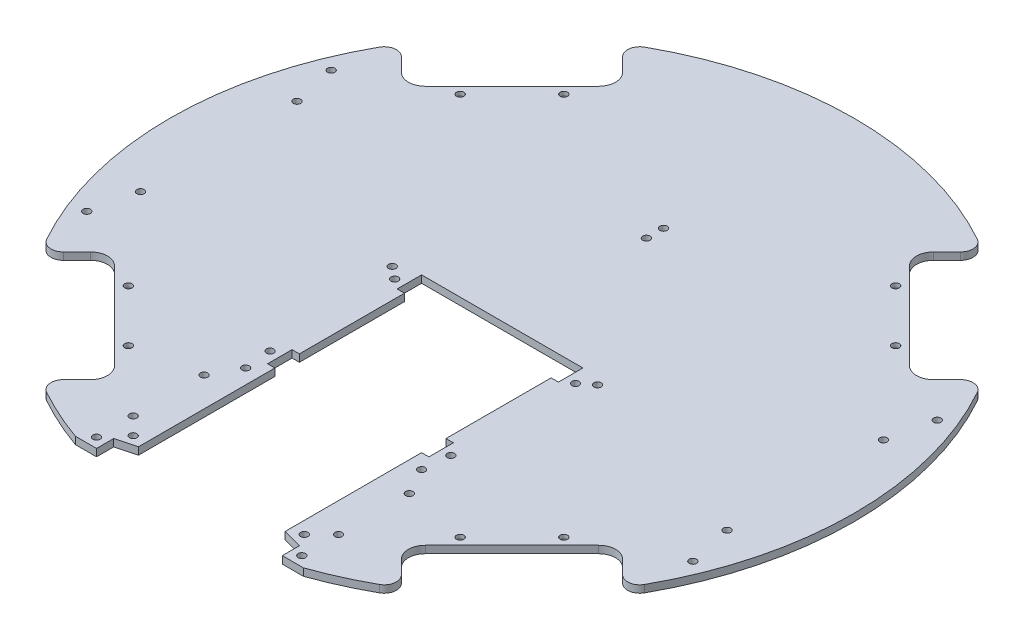
from build123d import *

# Parameters (mm, degrees)
SKETCH1_R                = 140
BOSS_EXTRUDE1_DEPTH      = 3
CUT_EXTRUDE4_REACH       = 200.013
CUT_EXTRUDE6_REACH       = 200.013
SKETCH9_R                = 1.5
FILLET1_R                = 5
CIRPATTERN1_COUNT        = 4
FILLET1_OF_CIRPATTERN1_R = 5
CUT_EXTRUDE1_REACH       = 200.013
FILLET3_R                = 1.5
CUT_EXTRUDE7_REACH       = 200.013
SKETCH10_R               = 1.5
CUT_EXTRUDE9_REACH       = 200.013
SKETCH13_R               = 1.5
CUT_EXTRUDE12_REACH      = 200.013
SKETCH16_R               = 1.5
CUT_EXTRUDE13_REACH      = 200.013
SKETCH17_R               = 1.5
CUT_EXTRUDE15_REACH      = 200.013
SKETCH19_R               = 1.5
CUT_EXTRUDE17_REACH      = 200.013
SKETCH21_R               = 1.5
CUT_EXTRUDE18_REACH      = 200.013
SKETCH22_R               = 1.5


with BuildPart() as part:
    # Sketch1 → Boss-Extrude1 (new body)
    with BuildSketch(Plane(origin=(0, 0, 0), x_dir=(1, 0, 0), z_dir=(0, 1, 0))):
        Circle(SKETCH1_R)
    extrude(amount=BOSS_EXTRUDE1_DEPTH)

    # Sketch7 → Cut-Extrude4 (cut, up to next)
    with BuildSketch(Plane(origin=(0, 3, 0), x_dir=(1, 0, 0), z_dir=(0, 1, 0)), mode=Mode.PRIVATE) as cut_extrude4_sk1:
        with BuildLine():
            Line((-99.030304705, -63.604254968), (-63.604254968, -99.030304705))
            ThreePointArc((-63.604254968, -99.030304705), (-61.568647097, -103.944696834), (-63.604254968, -108.859088964))
            Line((-63.604254968, -108.859088964), (-76.367532368, -121.622366364))
            Line((-76.367532368, -121.622366364), (-121.622366364, -76.367532368))
            Line((-121.622366364, -76.367532368), (-108.859088964, -63.604254968))
            ThreePointArc((-108.859088964, -63.604254968), (-103.944696834, -61.568647097), (-99.030304705, -63.604254968))
        make_face()
    cut_extrude4_tool1 = extrude(cut_extrude4_sk1.sketch, amount=-CUT_EXTRUDE4_REACH, mode=Mode.PRIVATE) & part.part
    cut_extrude4 = cut_extrude4_tool1.solids().sort_by_distance((-90.257735, 3, 90.257735))[0]
    add(cut_extrude4, mode=Mode.SUBTRACT)

    # Sketch9 → Cut-Extrude6 (cut, up to next)
    with BuildSketch(Plane(origin=(0, 3, 0), x_dir=(1, 0, 0), z_dir=(0, 1, 0)), mode=Mode.PRIVATE) as cut_extrude6_sk1:
        with Locations((-89.09545443, -67.882250994)):
            Circle(SKETCH9_R)
    cut_extrude6_tool1 = extrude(cut_extrude6_sk1.sketch, amount=-CUT_EXTRUDE6_REACH, mode=Mode.PRIVATE) & part.part
    # Sketch9 → Cut-Extrude6 (cut, up to next)
    with BuildSketch(Plane(origin=(0, 3, 0), x_dir=(1, 0, 0), z_dir=(0, 1, 0)), mode=Mode.PRIVATE) as cut_extrude6_sk2:
        with Locations((-67.882250994, -89.09545443)):
            Circle(SKETCH9_R)
    cut_extrude6_tool2 = extrude(cut_extrude6_sk2.sketch, amount=-CUT_EXTRUDE6_REACH, mode=Mode.PRIVATE) & part.part
    cut_extrude6_1 = cut_extrude6_tool1.solids().sort_by_distance((-89.095454, 3, 67.882251))[0]
    add(cut_extrude6_1, mode=Mode.SUBTRACT)
    cut_extrude6_2 = cut_extrude6_tool2.solids().sort_by_distance((-67.882251, 3, 89.095454))[0]
    add(cut_extrude6_2, mode=Mode.SUBTRACT)
    cut_extrude6 = cut_extrude6_1 + cut_extrude6_2  # Cut-Extrude6 as one shape, for the pattern or mirror that repeats it

    # Fillet1
    fillet1_edges = [part.edges().sort_by_distance(p)[0] for p in [
        (-73.746853427, 1.5, 119.001687423),
        (-119.001687423, 1.5, 73.746853427),
    ]]
    fillet(fillet1_edges, radius=FILLET1_R)

    # CirPattern1: Cut-Extrude4, Cut-Extrude6 ×4 about axis
    cirpattern1_axis = Axis((0, 3, 0), (0, 1, 0))
    add([cut_extrude4.rotate(cirpattern1_axis, i * 360 / CIRPATTERN1_COUNT) for i in range(1, CIRPATTERN1_COUNT)], mode=Mode.SUBTRACT)
    add([cut_extrude6.rotate(cirpattern1_axis, i * 360 / CIRPATTERN1_COUNT) for i in range(1, CIRPATTERN1_COUNT)], mode=Mode.SUBTRACT)

    # Fillet1 of CirPattern1
    fillet1_of_cirpattern1_edges = [part.edges().sort_by_distance(p)[0] for p in [
        (119.001687423, 1.5, 73.746853427),
        (73.746853427, 1.5, 119.001687423),
        (73.746853427, 1.5, -119.001687423),
        (119.001687423, 1.5, -73.746853427),
        (-119.001687423, 1.5, -73.746853427),
        (-73.746853427, 1.5, -119.001687423),
    ]]
    fillet(fillet1_of_cirpattern1_edges, radius=FILLET1_OF_CIRPATTERN1_R)

    # Sketch2 → Cut-Extrude1 (cut, up to next)
    with BuildSketch(Plane(origin=(0, 3, 0), x_dir=(1, 0, 0), z_dir=(0, 1, 0)), mode=Mode.PRIVATE) as cut_extrude1_sk1:
        Polygon((-46.647615159, -132), (-38, -132), (-38, -125), (-30, -122.856406461), (-30, -67), (-33, -67), (-33, -57), (-30, -57), (-30, -14), (-33, -14), (-33, -4), (33, -4), (33, -14), (30, -14), (30, -57), (33, -57), (33, -67), (30, -67), (30, -122.856406461), (38, -125), (38, -132), (46.647615159, -132), (46.647615159, -140), (-46.647615159, -140), align=None)
    cut_extrude1_tool1 = extrude(cut_extrude1_sk1.sketch, amount=-CUT_EXTRUDE1_REACH, mode=Mode.PRIVATE) & part.part
    add(cut_extrude1_tool1.solids().sort_by_distance((0, 3, 74.292867))[0], mode=Mode.SUBTRACT)

    # Fillet3
    fillet3_edges = [part.edges().sort_by_distance(p)[0] for p in [
        (67.882250994, 0, 90.59545443),
        (89.09545443, 0, 69.382250994),
        (90.59545443, 0, -67.882250994),
        (69.382250994, 0, -89.09545443),
        (-67.882250994, 0, -90.59545443),
        (-89.09545443, 0, -69.382250994),
        (-69.382250994, 0, 89.09545443),
        (-90.59545443, 0, 67.882250994),
    ]]
    fillet(fillet3_edges, radius=FILLET3_R)

    # Sketch10 → Cut-Extrude7 (cut, up to next)
    with BuildSketch(Plane(origin=(0, 3, 0), x_dir=(1, 0, 0), z_dir=(0, 1, 0)), mode=Mode.PRIVATE) as cut_extrude7_sk1:
        with Locations((-37, -62)):
            Circle(SKETCH10_R)
    cut_extrude7_tool1 = extrude(cut_extrude7_sk1.sketch, amount=-CUT_EXTRUDE7_REACH, mode=Mode.PRIVATE) & part.part
    # Sketch10 → Cut-Extrude7 (cut, up to next)
    with BuildSketch(Plane(origin=(0, 3, 0), x_dir=(1, 0, 0), z_dir=(0, 1, 0)), mode=Mode.PRIVATE) as cut_extrude7_sk2:
        with Locations((37, -62)):
            Circle(SKETCH10_R)
    cut_extrude7_tool2 = extrude(cut_extrude7_sk2.sketch, amount=-CUT_EXTRUDE7_REACH, mode=Mode.PRIVATE) & part.part
    # Sketch10 → Cut-Extrude7 (cut, up to next)
    with BuildSketch(Plane(origin=(0, 3, 0), x_dir=(1, 0, 0), z_dir=(0, 1, 0)), mode=Mode.PRIVATE) as cut_extrude7_sk3:
        with Locations((-37, -11)):
            Circle(SKETCH10_R)
    cut_extrude7_tool3 = extrude(cut_extrude7_sk3.sketch, amount=-CUT_EXTRUDE7_REACH, mode=Mode.PRIVATE) & part.part
    # Sketch10 → Cut-Extrude7 (cut, up to next)
    with BuildSketch(Plane(origin=(0, 3, 0), x_dir=(1, 0, 0), z_dir=(0, 1, 0)), mode=Mode.PRIVATE) as cut_extrude7_sk4:
        with Locations((37, -11)):
            Circle(SKETCH10_R)
    cut_extrude7_tool4 = extrude(cut_extrude7_sk4.sketch, amount=-CUT_EXTRUDE7_REACH, mode=Mode.PRIVATE) & part.part
    # Sketch10 → Cut-Extrude7 (cut, up to next)
    with BuildSketch(Plane(origin=(0, 3, 0), x_dir=(1, 0, 0), z_dir=(0, 1, 0)), mode=Mode.PRIVATE) as cut_extrude7_sk5:
        with Locations((-42, -7)):
            Circle(SKETCH10_R)
    cut_extrude7_tool5 = extrude(cut_extrude7_sk5.sketch, amount=-CUT_EXTRUDE7_REACH, mode=Mode.PRIVATE) & part.part
    # Sketch10 → Cut-Extrude7 (cut, up to next)
    with BuildSketch(Plane(origin=(0, 3, 0), x_dir=(1, 0, 0), z_dir=(0, 1, 0)), mode=Mode.PRIVATE) as cut_extrude7_sk6:
        with Locations((42, -7)):
            Circle(SKETCH10_R)
    cut_extrude7_tool6 = extrude(cut_extrude7_sk6.sketch, amount=-CUT_EXTRUDE7_REACH, mode=Mode.PRIVATE) & part.part
    add(cut_extrude7_tool1.solids().sort_by_distance((-37, 3, 62))[0], mode=Mode.SUBTRACT)
    add(cut_extrude7_tool2.solids().sort_by_distance((37, 3, 62))[0], mode=Mode.SUBTRACT)
    add(cut_extrude7_tool3.solids().sort_by_distance((-37, 3, 11))[0], mode=Mode.SUBTRACT)
    add(cut_extrude7_tool4.solids().sort_by_distance((37, 3, 11))[0], mode=Mode.SUBTRACT)
    add(cut_extrude7_tool5.solids().sort_by_distance((-42, 3, 7))[0], mode=Mode.SUBTRACT)
    add(cut_extrude7_tool6.solids().sort_by_distance((42, 3, 7))[0], mode=Mode.SUBTRACT)

    # Sketch13 → Cut-Extrude9 (cut, up to next)
    with BuildSketch(Plane(origin=(0, 3, 0), x_dir=(1, 0, 0), z_dir=(0, 1, 0)), mode=Mode.PRIVATE) as cut_extrude9_sk1:
        with Locations((-42, -84)):
            Circle(SKETCH13_R)
    cut_extrude9_tool1 = extrude(cut_extrude9_sk1.sketch, amount=-CUT_EXTRUDE9_REACH, mode=Mode.PRIVATE) & part.part
    # Sketch13 → Cut-Extrude9 (cut, up to next)
    with BuildSketch(Plane(origin=(0, 3, 0), x_dir=(1, 0, 0), z_dir=(0, 1, 0)), mode=Mode.PRIVATE) as cut_extrude9_sk2:
        with Locations((-42, -113)):
            Circle(SKETCH13_R)
    cut_extrude9_tool2 = extrude(cut_extrude9_sk2.sketch, amount=-CUT_EXTRUDE9_REACH, mode=Mode.PRIVATE) & part.part
    # Sketch13 → Cut-Extrude9 (cut, up to next)
    with BuildSketch(Plane(origin=(0, 3, 0), x_dir=(1, 0, 0), z_dir=(0, 1, 0)), mode=Mode.PRIVATE) as cut_extrude9_sk3:
        with Locations((42, -113)):
            Circle(SKETCH13_R)
    cut_extrude9_tool3 = extrude(cut_extrude9_sk3.sketch, amount=-CUT_EXTRUDE9_REACH, mode=Mode.PRIVATE) & part.part
    # Sketch13 → Cut-Extrude9 (cut, up to next)
    with BuildSketch(Plane(origin=(0, 3, 0), x_dir=(1, 0, 0), z_dir=(0, 1, 0)), mode=Mode.PRIVATE) as cut_extrude9_sk4:
        with Locations((42, -84)):
            Circle(SKETCH13_R)
    cut_extrude9_tool4 = extrude(cut_extrude9_sk4.sketch, amount=-CUT_EXTRUDE9_REACH, mode=Mode.PRIVATE) & part.part
    add(cut_extrude9_tool1.solids().sort_by_distance((-42, 3, 84))[0], mode=Mode.SUBTRACT)
    add(cut_extrude9_tool2.solids().sort_by_distance((-42, 3, 113))[0], mode=Mode.SUBTRACT)
    add(cut_extrude9_tool3.solids().sort_by_distance((42, 3, 113))[0], mode=Mode.SUBTRACT)
    add(cut_extrude9_tool4.solids().sort_by_distance((42, 3, 84))[0], mode=Mode.SUBTRACT)

    # Sketch16 → Cut-Extrude12 (cut, up to next)
    with BuildSketch(Plane(origin=(0, 3, 0), x_dir=(1, 0, 0), z_dir=(0, 1, 0)), mode=Mode.PRIVATE) as cut_extrude12_sk1:
        with Locations((0, 62)):
            Circle(SKETCH16_R)
    cut_extrude12_tool1 = extrude(cut_extrude12_sk1.sketch, amount=-CUT_EXTRUDE12_REACH, mode=Mode.PRIVATE) & part.part
    # Sketch16 → Cut-Extrude12 (cut, up to next)
    with BuildSketch(Plane(origin=(0, 3, 0), x_dir=(1, 0, 0), z_dir=(0, 1, 0)), mode=Mode.PRIVATE) as cut_extrude12_sk2:
        with Locations((0, 55)):
            Circle(SKETCH16_R)
    cut_extrude12_tool2 = extrude(cut_extrude12_sk2.sketch, amount=-CUT_EXTRUDE12_REACH, mode=Mode.PRIVATE) & part.part
    add(cut_extrude12_tool1.solids().sort_by_distance((0, 3, -62))[0], mode=Mode.SUBTRACT)
    add(cut_extrude12_tool2.solids().sort_by_distance((0, 3, -55))[0], mode=Mode.SUBTRACT)

    # Sketch17 → Cut-Extrude13 (cut, up to next)
    with BuildSketch(Plane(origin=(0, 3, 0), x_dir=(1, 0, 0), z_dir=(0, 1, 0)), mode=Mode.PRIVATE) as cut_extrude13_sk1:
        with Locations((-124, 50)):
            Circle(SKETCH17_R)
    cut_extrude13_tool1 = extrude(cut_extrude13_sk1.sketch, amount=-CUT_EXTRUDE13_REACH, mode=Mode.PRIVATE) & part.part
    # Sketch17 → Cut-Extrude13 (cut, up to next)
    with BuildSketch(Plane(origin=(0, 3, 0), x_dir=(1, 0, 0), z_dir=(0, 1, 0)), mode=Mode.PRIVATE) as cut_extrude13_sk2:
        with Locations((-124, -50)):
            Circle(SKETCH17_R)
    cut_extrude13_tool2 = extrude(cut_extrude13_sk2.sketch, amount=-CUT_EXTRUDE13_REACH, mode=Mode.PRIVATE) & part.part
    # Sketch17 → Cut-Extrude13 (cut, up to next)
    with BuildSketch(Plane(origin=(0, 3, 0), x_dir=(1, 0, 0), z_dir=(0, 1, 0)), mode=Mode.PRIVATE) as cut_extrude13_sk3:
        with Locations((124, 50)):
            Circle(SKETCH17_R)
    cut_extrude13_tool3 = extrude(cut_extrude13_sk3.sketch, amount=-CUT_EXTRUDE13_REACH, mode=Mode.PRIVATE) & part.part
    # Sketch17 → Cut-Extrude13 (cut, up to next)
    with BuildSketch(Plane(origin=(0, 3, 0), x_dir=(1, 0, 0), z_dir=(0, 1, 0)), mode=Mode.PRIVATE) as cut_extrude13_sk4:
        with Locations((124, -50)):
            Circle(SKETCH17_R)
    cut_extrude13_tool4 = extrude(cut_extrude13_sk4.sketch, amount=-CUT_EXTRUDE13_REACH, mode=Mode.PRIVATE) & part.part
    add(cut_extrude13_tool1.solids().sort_by_distance((-124, 3, -50))[0], mode=Mode.SUBTRACT)
    add(cut_extrude13_tool2.solids().sort_by_distance((-124, 3, 50))[0], mode=Mode.SUBTRACT)
    add(cut_extrude13_tool3.solids().sort_by_distance((124, 3, -50))[0], mode=Mode.SUBTRACT)
    add(cut_extrude13_tool4.solids().sort_by_distance((124, 3, 50))[0], mode=Mode.SUBTRACT)

    # Sketch19 → Cut-Extrude15 (cut, up to next)
    with BuildSketch(Plane(origin=(0, 3, 0), x_dir=(1, 0, 0), z_dir=(0, 1, 0)), mode=Mode.PRIVATE) as cut_extrude15_sk1:
        with Locations((-42, -128)):
            Circle(SKETCH19_R)
    cut_extrude15_tool1 = extrude(cut_extrude15_sk1.sketch, amount=-CUT_EXTRUDE15_REACH, mode=Mode.PRIVATE) & part.part
    # Sketch19 → Cut-Extrude15 (cut, up to next)
    with BuildSketch(Plane(origin=(0, 3, 0), x_dir=(1, 0, 0), z_dir=(0, 1, 0)), mode=Mode.PRIVATE) as cut_extrude15_sk2:
        with Locations((42, -128)):
            Circle(SKETCH19_R)
    cut_extrude15_tool2 = extrude(cut_extrude15_sk2.sketch, amount=-CUT_EXTRUDE15_REACH, mode=Mode.PRIVATE) & part.part
    add(cut_extrude15_tool1.solids().sort_by_distance((-42, 3, 128))[0], mode=Mode.SUBTRACT)
    add(cut_extrude15_tool2.solids().sort_by_distance((42, 3, 128))[0], mode=Mode.SUBTRACT)

    # Sketch21 → Cut-Extrude17 (cut, up to next)
    with BuildSketch(Plane(origin=(0, 3, 0), x_dir=(1, 0, 0), z_dir=(0, 1, 0)), mode=Mode.PRIVATE) as cut_extrude17_sk1:
        with Locations((-35, -120)):
            Circle(SKETCH21_R)
    cut_extrude17_tool1 = extrude(cut_extrude17_sk1.sketch, amount=-CUT_EXTRUDE17_REACH, mode=Mode.PRIVATE) & part.part
    # Sketch21 → Cut-Extrude17 (cut, up to next)
    with BuildSketch(Plane(origin=(0, 3, 0), x_dir=(1, 0, 0), z_dir=(0, 1, 0)), mode=Mode.PRIVATE) as cut_extrude17_sk2:
        with Locations((-36, -73)):
            Circle(SKETCH21_R)
    cut_extrude17_tool2 = extrude(cut_extrude17_sk2.sketch, amount=-CUT_EXTRUDE17_REACH, mode=Mode.PRIVATE) & part.part
    # Sketch21 → Cut-Extrude17 (cut, up to next)
    with BuildSketch(Plane(origin=(0, 3, 0), x_dir=(1, 0, 0), z_dir=(0, 1, 0)), mode=Mode.PRIVATE) as cut_extrude17_sk3:
        with Locations((35, -120)):
            Circle(SKETCH21_R)
    cut_extrude17_tool3 = extrude(cut_extrude17_sk3.sketch, amount=-CUT_EXTRUDE17_REACH, mode=Mode.PRIVATE) & part.part
    # Sketch21 → Cut-Extrude17 (cut, up to next)
    with BuildSketch(Plane(origin=(0, 3, 0), x_dir=(1, 0, 0), z_dir=(0, 1, 0)), mode=Mode.PRIVATE) as cut_extrude17_sk4:
        with Locations((36, -73)):
            Circle(SKETCH21_R)
    cut_extrude17_tool4 = extrude(cut_extrude17_sk4.sketch, amount=-CUT_EXTRUDE17_REACH, mode=Mode.PRIVATE) & part.part
    add(cut_extrude17_tool1.solids().sort_by_distance((-35, 3, 120))[0], mode=Mode.SUBTRACT)
    add(cut_extrude17_tool2.solids().sort_by_distance((-36, 3, 73))[0], mode=Mode.SUBTRACT)
    add(cut_extrude17_tool3.solids().sort_by_distance((35, 3, 120))[0], mode=Mode.SUBTRACT)
    add(cut_extrude17_tool4.solids().sort_by_distance((36, 3, 73))[0], mode=Mode.SUBTRACT)

    # Sketch22 → Cut-Extrude18 (cut, up to next)
    with BuildSketch(Plane(origin=(0, 3, 0), x_dir=(1, 0, 0), z_dir=(0, 1, 0)), mode=Mode.PRIVATE) as cut_extrude18_sk1:
        with Locations((120, 32)):
            Circle(SKETCH22_R)
    cut_extrude18_tool1 = extrude(cut_extrude18_sk1.sketch, amount=-CUT_EXTRUDE18_REACH, mode=Mode.PRIVATE) & part.part
    # Sketch22 → Cut-Extrude18 (cut, up to next)
    with BuildSketch(Plane(origin=(0, 3, 0), x_dir=(1, 0, 0), z_dir=(0, 1, 0)), mode=Mode.PRIVATE) as cut_extrude18_sk2:
        with Locations((120, -32)):
            Circle(SKETCH22_R)
    cut_extrude18_tool2 = extrude(cut_extrude18_sk2.sketch, amount=-CUT_EXTRUDE18_REACH, mode=Mode.PRIVATE) & part.part
    # Sketch22 → Cut-Extrude18 (cut, up to next)
    with BuildSketch(Plane(origin=(0, 3, 0), x_dir=(1, 0, 0), z_dir=(0, 1, 0)), mode=Mode.PRIVATE) as cut_extrude18_sk3:
        with Locations((-120, 32)):
            Circle(SKETCH22_R)
    cut_extrude18_tool3 = extrude(cut_extrude18_sk3.sketch, amount=-CUT_EXTRUDE18_REACH, mode=Mode.PRIVATE) & part.part
    # Sketch22 → Cut-Extrude18 (cut, up to next)
    with BuildSketch(Plane(origin=(0, 3, 0), x_dir=(1, 0, 0), z_dir=(0, 1, 0)), mode=Mode.PRIVATE) as cut_extrude18_sk4:
        with Locations((-120, -32)):
            Circle(SKETCH22_R)
    cut_extrude18_tool4 = extrude(cut_extrude18_sk4.sketch, amount=-CUT_EXTRUDE18_REACH, mode=Mode.PRIVATE) & part.part
    add(cut_extrude18_tool1.solids().sort_by_distance((120, 3, -32))[0], mode=Mode.SUBTRACT)
    add(cut_extrude18_tool2.solids().sort_by_distance((120, 3, 32))[0], mode=Mode.SUBTRACT)
    add(cut_extrude18_tool3.solids().sort_by_distance((-120, 3, -32))[0], mode=Mode.SUBTRACT)
    add(cut_extrude18_tool4.solids().sort_by_distance((-120, 3, 32))[0], mode=Mode.SUBTRACT)


solid = part.part
